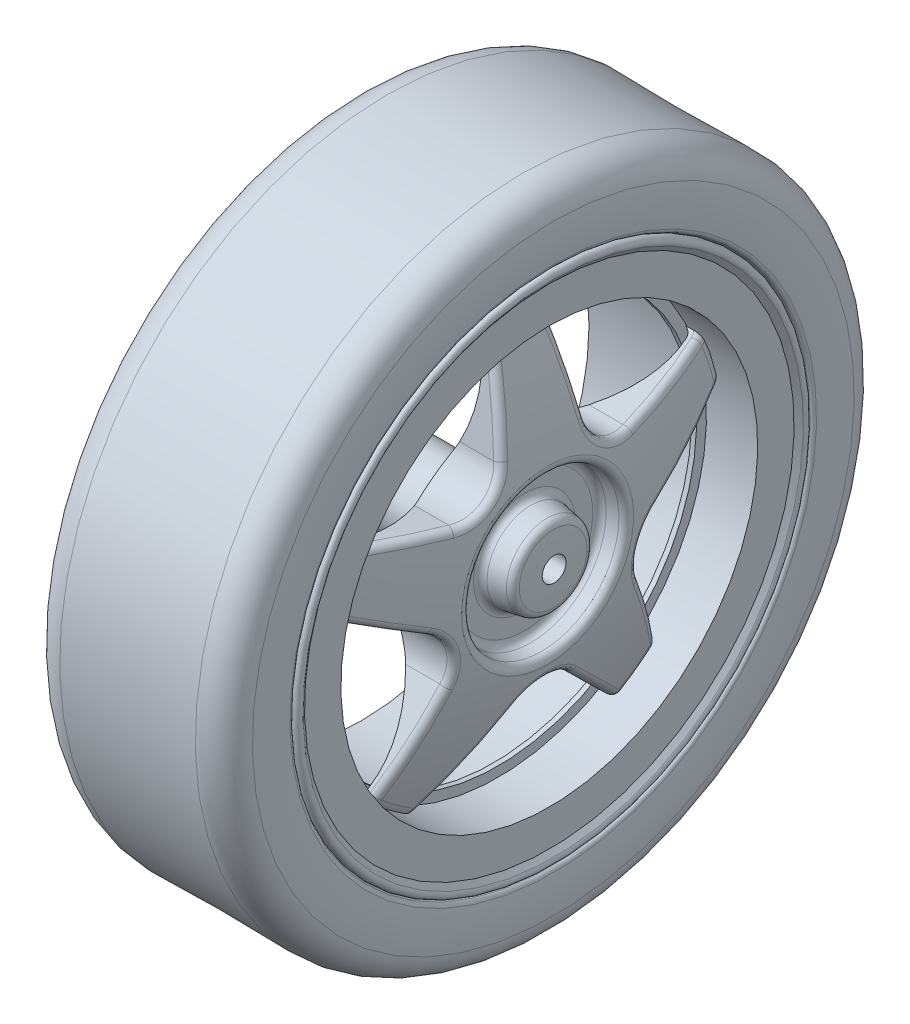
from build123d import *

# Parameters (mm, degrees)
CORTAR_EXTRUIR1_START = 28.999999999999996
CORTAR_EXTRUIR1_DEPTH = 28.999999999999996
MATRIZC1_COUNT        = 5
REDONDEO1_R           = 0.75
REDONDEO2_R           = 0.75
CORTAR_EXTRUIR2_DEPTH = 10


# Read off the part's stored shape, not the designer's step: Cortar-Revolución4
with BuildPart() as part:
    # Croquis1 → Revolución1 (revolve)
    with BuildSketch(Plane.XY):
        with BuildLine():
            Line((2.5, 24.999999999999996), (0.7352941176470583, 25.941176470588232))
            ThreePointArc((0.7352941176470584, 25.941176470588232), (0.12020814131487928, 25.825204772530324), (0.1003018758116564, 25.19959792024635))
            Line((0.10030187581165623, 25.19959792024635), (0.5, 24.667782059947733))
            Line((0.5, 24.667782059947733), (0.5000000000000004, 20.999999999999996))
            Line((0.5000000000000004, 20.999999999999996), (13.83221794005226, 20.999999999999996))
            Line((13.83221794005226, 20.999999999999996), (15.83221794005226, 20.999999999999996))
            Line((15.83221794005226, 20.999999999999996), (19.5, 20.999999999999996))
            Line((19.5, 20.999999999999996), (19.5, 24.667782059947736))
            Line((19.5, 24.667782059947736), (19.899698124188344, 25.19959792024635))
            ThreePointArc((19.899698124188347, 25.19959792024635), (19.879791858685124, 25.825204772530324), (19.264705882352946, 25.941176470588236))
            Line((19.264705882352946, 25.941176470588236), (17.499999999999996, 25))
            Line((17.499999999999996, 25), (2.5, 24.999999999999996))
        make_face()
    revolve(axis=Axis((20, 0, 0), (-1, -1.2e-16, 0)))


with BuildPart() as body_2:
    # Croquis1<3> → Revolución2 (revolve)
    with BuildSketch(Plane.XY):
        with BuildLine():
            ThreePointArc((15.229709414249836, 20.044993192200682), (14.678536500553854, 20.73844454625571), (13.83221794005226, 20.999999999999996))
            Line((13.83221794005226, 20.999999999999996), (15.83221794005226, 20.999999999999996))
            ThreePointArc((15.83221794005226, 20.999999999999996), (16.01691722525036, 20.715355517227323), (16.161370397048206, 20.408321987001138))
            ThreePointArc((16.161370397048206, 20.408321987001138), (18.159269913999402, 14.261864726586808), (19.437899090853012, 7.926594664305913))
            Line((19.437899090853012, 7.926594664305913), (17.000000000000004, 7.5))
            Line((17.000000000000004, 7.5), (16.999999999999996, 4.500000000000001))
            Line((16.999999999999996, 4.500000000000001), (19.857395198343077, 4))
            ThreePointArc((19.857395198343077, 4), (19.96433747853814, 2.0012706044820376), (20, 0))
            Line((20, 0), (-4.999999999999995, -3.06e-15))
            Line((-4.999999999999995, -3.06e-15), (-4.999999999999994, 4))
            Line((-4.999999999999994, 4), (7.41803141324657, 6.172963582434665))
            ThreePointArc((7.41803141324657, 6.172963582434665), (14.609153979008614, 11.25895513363789), (15.229709414249836, 20.044993192200682))
        make_face()
    revolve(axis=Axis((20, 0, 0), (-1, -1.2e-16, 0)))

    # Croquis2 → Cortar-Extruir1 (cut)
    with BuildSketch(Plane(origin=(0, 0, 0), x_dir=(0, 0, -1), z_dir=(1, 0, 0)).offset(CORTAR_EXTRUIR1_START)):
        with BuildLine():
            ThreePointArc((-19.032482471529132, 8.874942871418174), (-12.343490298141932, 16.989356881873892), (-2.5592117207636766, 20.843474647196086))
            Line((-2.5592117207636766, 20.843474647196086), (-4.238740146298038, 10.618509398268122))
            ThreePointArc((-4.238740146298038, 10.618509398268122), (-5.834705949164168, 8.030783779695161), (-8.788959816618782, 7.312581296013566))
            Line((-8.788959816618782, 7.312581296013566), (-19.032482471529132, 8.874942871418174))
        make_face()
    cortar_extruir1 = extrude(amount=-CORTAR_EXTRUIR1_DEPTH, mode=Mode.SUBTRACT)

    # MatrizC1: Cortar-Extruir1 ×5 about axis
    matrizc1_axis = Axis((0, 1.5e-15, -3.8e-16), (1, 0, 0))
    for i in range(1, MATRIZC1_COUNT):
        add(cortar_extruir1.rotate(matrizc1_axis, i * 360 / MATRIZC1_COUNT), mode=Mode.SUBTRACT)


with BuildPart() as cortar_revoluci_n1_tool:
    # Croquis3 → Cortar-Revolución1 (revolve)
    with BuildSketch(Plane.XY):
        Polygon((14.332217940052262, 19.499999999999996), (14.332217940052264, 22.499999999999993), (14.332217940052264, 22.999999999999993), (13.83221794005226, 22.999999999999993), (13.83221794005226, 20.999999999999996), (13.83221794005226, 19.499999999999996), align=None)
        Polygon((13.83221794005226, 20.999999999999996), (13.83221794005226, 22.999999999999993), (-1.1677820599477382, 22.999999999999986), (-1.1677820599477386, 20.999999999999982), align=None)
    revolve(axis=Axis((7.418031413246568, -1.54e-15, 0), (-1, -1.2e-16, 0)))


with BuildPart() as part_1:
    add(part.part)

    # Cortar-Revolución1: cut by cortar_revoluci_n1_tool
    add(cortar_revoluci_n1_tool.part, mode=Mode.SUBTRACT)

    # Croquis4 → Revolución3 (revolve)
    with BuildSketch(Plane.XY):
        with BuildLine():
            Line((14.332217940052264, 22.999999999999993), (13.832217940052262, 22.999999999999993))
            Line((13.832217940052262, 22.999999999999993), (12.332217940052265, 22.999999999999996))
            ThreePointArc((12.332217940052265, 22.999999999999996), (13.392878111832086, 22.56066017177982), (13.832217940052262, 21.499999999999996))
            Line((13.832217940052262, 21.499999999999996), (13.832217940052262, 19.999999999999996))
            Line((13.832217940052262, 19.999999999999996), (14.332217940052264, 19.999999999999996))
            Line((14.332217940052264, 19.999999999999996), (14.332217940052264, 22.999999999999993))
        make_face()
    revolve(axis=Axis((7.418031413246568, -1.54e-15, 0), (-1, -1.2e-16, 0)))


with BuildPart() as body_2_1:
    add(body_2.part)

    # Cortar-Revolución1: cut by cortar_revoluci_n1_tool
    add(cortar_revoluci_n1_tool.part, mode=Mode.SUBTRACT)

    # Redondeo1
    redondeo1_edges = [body_2_1.edges().sort_by_distance(p)[0] for p in [
        (16.017390352561375, -18.157716094822753, -9.969355513847564),
        (17.713468801645313, -14.549912860999985, -6.320010510851247),
        (19.115914274162588, -9.926594664307888, -2.471356e-11),
        (16.017390352561375, -18.157716094822757, 9.969355513847558),
        (17.713468801645313, -14.549912860999985, 6.320010510851239),
        (17.000000000000004, -7.5, -4.25e-15),
        (16.01739035256137, -15.09246337704348, 14.188313936274088),
        (17.713468801645327, -10.506857520122566, 11.884798785499381),
        (19.11591427416263, -3.067486447566317, 9.44075254010308),
        (16.017390352561375, 3.870377672372002, 20.349714489763052),
        (17.713468801645355, 1.514516838675414, 15.79078009046219),
        (16.999999999999996, -4.500000000000001, -5.5e-16),
        (19.857395198343077, -4, -4.9e-16),
        (19.11591427416269, 8.030783779682231, 5.834705949185325),
        (16.01739035256137, 20.54974104564736, 2.607459702182234),
        (17.713468801645412, 15.485935743835702, 3.4392282939293777),
        (16.01739035256137, 8.830060753846865, 18.738215769518757),
        (17.71346880164539, 8.056317798611854, 13.665220109743553),
        (16.01739035256137, 20.54974104564736, -2.607459702182232),
        (17.713468801645405, 15.485935743835707, -3.439228293929376),
        (19.11591427416269, 8.030783779711285, -5.834705949145338),
        (16.01739035256137, 8.830060753846867, -18.738215769518757),
        (17.71346880164539, 8.056317798611854, -13.665220109743546),
        (16.01739035256137, 3.870377672372008, -20.349714489763052),
        (17.713468801645355, 1.5145168386754158, -15.790780090462187),
        (19.115914274162627, -3.0674864475193098, -9.440752540118355),
        (16.017390352561375, -15.092463377043474, -14.18831393627409),
        (17.713468801645327, -10.506857520122566, -11.884798785499385),
    ]]
    fillet(redondeo1_edges, radius=REDONDEO1_R)

    # Cortar-Revolución4 outline → Cortar-Revolución4 (revolve, cut)
    with BuildSketch(Plane.YX):
        Polygon((4, -5), (6.172963582, 7.418031413), (10.776802277, 7.418031413), (10.776802277, 14.320012605), (4, 10), align=None)
    revolve(axis=Axis((0, 0, 0), (1, 0, 0)), mode=Mode.SUBTRACT)

    # Redondeo2
    redondeo2_edges = [body_2_1.edges().sort_by_distance(p)[0] for p in [
        (19.437899090853016, -7.926594664305911, -9.7e-16),
    ]]
    fillet(redondeo2_edges, radius=REDONDEO2_R)

    # Croquis8 → Cortar-Extruir2 (cut)
    with BuildSketch(Plane.ZY.offset(4.999999999999994)):
        with BuildLine():
            Line((-1.7999999999999998, 2.012461179749811), (-1.7999999999999998, -2.012461179749811))
            ThreePointArc((-1.7999999999999998, -2.012461179749811), (3.8e-16, -2.6999999999999966), (1.8000000000000003, -2.012461179749811))
            Line((1.8000000000000003, -2.012461179749811), (1.8000000000000003, 2.012461179749811))
            ThreePointArc((1.8000000000000003, 2.012461179749811), (3.8e-16, 2.6999999999999993), (-1.7999999999999998, 2.012461179749811))
        make_face()
    extrude(amount=-CORTAR_EXTRUIR2_DEPTH, mode=Mode.SUBTRACT)

    # Sketch7 → M2 Clearance Hole2 (revolve, cut)
    with BuildSketch(Plane(origin=(19.999999999999996, 0, 0), x_dir=(0, 0, -1), z_dir=(0, 1, 0))):
        Polygon((0, 0), (-6.12e-15, 24.99999999999999), (1.1999999999999962, 24.99999999999999), (1.1999999999999875, -1.41e-15), align=None)
    revolve(axis=Axis((26.349999999999987, 0, 0), (-1, 0, 0)), mode=Mode.SUBTRACT)


with BuildPart() as body_3:
    # Croquis7 → Revolución4 (revolve)
    with BuildSketch(Plane.XY):
        with BuildLine():
            Line((19.638075261313737, 26.140306806033994), (17.499999999999996, 25))
            Line((17.499999999999996, 25), (2.5, 24.999999999999996))
            Line((2.5, 24.999999999999996), (0.36192473868625213, 26.140306806033994))
            ThreePointArc((0.36192473868625213, 26.140306806033994), (0.18263537681055253, 26.30198276051036), (0.1, 26.528820112013626))
            ThreePointArc((0.1, 26.528820112013626), (7.11e-15, 28.422399549832626), (0.1, 30.315978987651633))
            ThreePointArc((0.1, 30.315978987651633), (1.1092664497680278, 32.259012986390495), (3.170041743989857, 32.998746096104654))
            ThreePointArc((3.170041743989857, 32.998746096104654), (10.000000000000023, 32.89999999999998), (16.829958256010144, 32.998746096104654))
            ThreePointArc((16.829958256010144, 32.998746096104654), (18.89073355023197, 32.25901298639051), (19.900000000000006, 30.31597898765165))
            ThreePointArc((19.900000000000006, 30.31597898765165), (20.00000000000001, 28.422399549832637), (19.899999999999995, 26.528820112013623))
            ThreePointArc((19.899999999999995, 26.528820112013623), (19.81736462318944, 26.301982760510352), (19.638075261313737, 26.140306806033994))
        make_face()
    revolve(axis=Axis((20, 0, 0), (-1, -1.2e-16, 0)))


solid = Compound([part_1.part, body_2_1.part, body_3.part])
